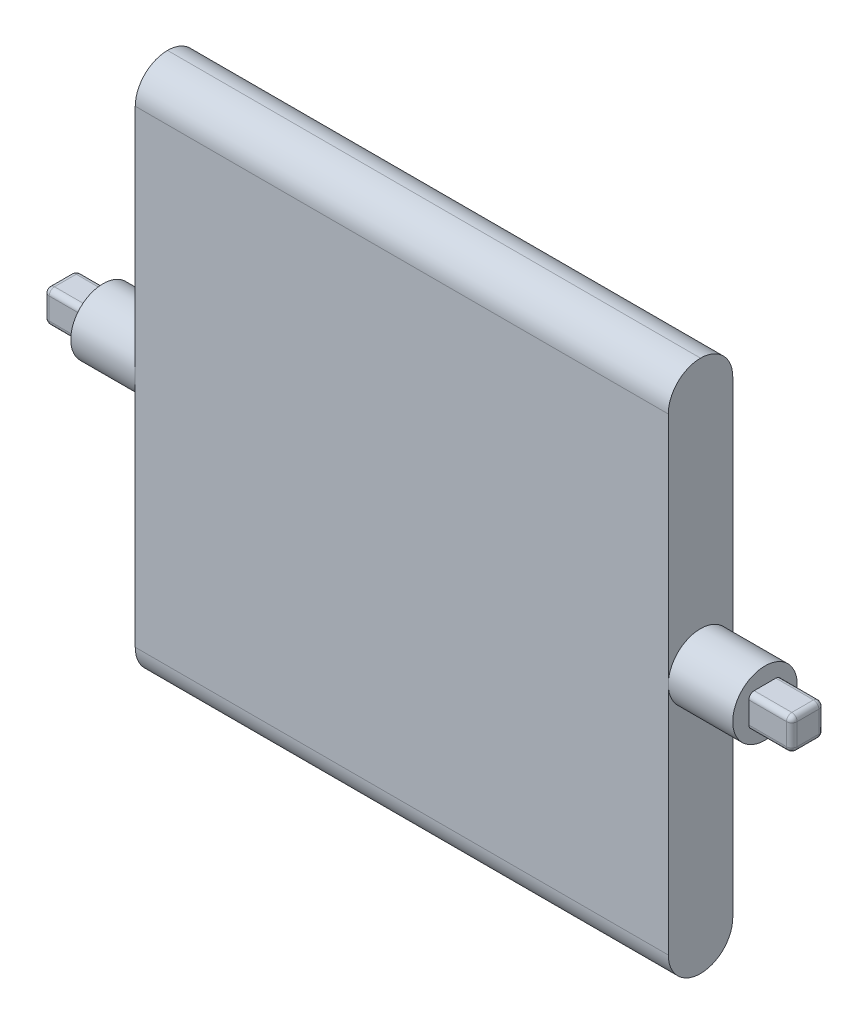
from build123d import *

# Parameters (mm, degrees)
SKETCH1_W           = 78.74
SKETCH1_H           = 78.74
BOSS_EXTRUDE1_DEPTH = 4.7625
SKETCH2_R           = 4.7625
BOSS_EXTRUDE2_DEPTH = 9.525
SKETCH3_W           = 4.7752
SKETCH3_H           = 4.7752
BOSS_EXTRUDE3_DEPTH = 6.35
FILLET2_R           = 4.7625
FILLET3_R           = 0.7874
FILLET4_R           = 0.7874
FILLET5_R           = 0.7874


# Some blends are built 0.0001 mm under size
with BuildPart() as part:
    # Sketch1 → Boss-Extrude1 (new, symmetric)
    with BuildSketch(Plane.XY):
        Rectangle(SKETCH1_W, SKETCH1_H)
    extrude(amount=BOSS_EXTRUDE1_DEPTH, both=True)

    # Sketch2 → Boss-Extrude2 (add)
    with BuildSketch(Plane(origin=(39.37, 0, 0), x_dir=(0, 0, -1), z_dir=(1, 0, 0))):
        Circle(SKETCH2_R)
    boss_extrude2 = extrude(amount=BOSS_EXTRUDE2_DEPTH)

    # Sketch3 → Boss-Extrude3 (add)
    with BuildSketch(Plane(origin=(48.895, 0, 0), x_dir=(0, 0, -1), z_dir=(1, 0, 0))):
        Rectangle(SKETCH3_W, SKETCH3_H)
    boss_extrude3 = extrude(amount=BOSS_EXTRUDE3_DEPTH)

    # Mirror1: Boss-Extrude2, Boss-Extrude3 across plane
    add(boss_extrude2.mirror(Plane(origin=(0, 0, 0), x_dir=(0, 0, 1), z_dir=(1, 0, 0))))
    add(boss_extrude3.mirror(Plane(origin=(0, 0, 0), x_dir=(0, 0, 1), z_dir=(1, 0, 0))))

    # Fillet2
    fillet2_edges = [part.edges().sort_by_distance(p)[0] for p in [
        (0, -39.37, -4.7625),
        (0, -39.37, 4.7625),
        (0, 39.37, -4.7625),
        (0, 39.37, 4.7625),
    ]]
    fillet(fillet2_edges, radius=FILLET2_R - 0.0001)  # a hair under: the kernel refuses the full size

    # Fillet3
    fillet3_edges = [part.edges().sort_by_distance(p)[0] for p in [
        (-55.245, 0, -2.3876),
        (-55.245, -2.3876, 0),
        (-55.245, 0, 2.3876),
        (-55.245, 2.3876, 0),
    ]]
    fillet(fillet3_edges, radius=FILLET3_R)

    # Fillet4
    fillet4_edges = [part.edges().sort_by_distance(p)[0] for p in [
        (55.245, 0, -2.3876),
        (55.245, 2.3876, 0),
        (55.245, 0, 2.3876),
        (55.245, -2.3876, 0),
    ]]
    fillet(fillet4_edges, radius=FILLET4_R)

    # Fillet5
    # the kernel refuses this fillet: 0.7874 mm, written as the material it takes off along each edge
    with BuildSketch(Plane(origin=(54.4576, -1.6002, -1.6002), x_dir=(0, 0, -1), z_dir=(0, -1, 0))) as fillet5_piece_1_section:
        Polygon((0, 0), (FILLET5_R, 0), (FILLET5_R, FILLET5_R), (0, FILLET5_R), align=None)
    fillet5_piece_1 = extrude(amount=FILLET5_R, mode=Mode.PRIVATE)
    fillet5_piece_1 = fillet5_piece_1 - Plane(origin=(54.4576, -1.6002, -1.6002), x_dir=(-0.7071067811865475, 0, 0.7071067811865475), z_dir=(0, -1, 0)) * Sphere(FILLET5_R, mode=Mode.PRIVATE)
    add(fillet5_piece_1, mode=Mode.SUBTRACT)
    with BuildSketch(Plane(origin=(54.4576, -1.6002, 1.6002), x_dir=(0, 0, 1), z_dir=(0, -1, 0))) as fillet5_piece_2_section:
        Polygon((0, 0), (FILLET5_R, 0), (FILLET5_R, -FILLET5_R), (0, -FILLET5_R), align=None)
    fillet5_piece_2 = extrude(amount=FILLET5_R, mode=Mode.PRIVATE)
    fillet5_piece_2 = fillet5_piece_2 - Plane(origin=(54.4576, -1.6002, 1.6002), x_dir=(-0.7071067811865475, 0, -0.7071067811865475), z_dir=(0, -1, 0)) * Sphere(FILLET5_R, mode=Mode.PRIVATE)
    add(fillet5_piece_2, mode=Mode.SUBTRACT)
    with BuildSketch(Plane(origin=(54.4576, 1.6002, -1.6002), x_dir=(0, 1, 0), z_dir=(0, 0, -1))) as fillet5_piece_3_section:
        Polygon((0, 0), (FILLET5_R, 0), (FILLET5_R, FILLET5_R), (0, FILLET5_R), align=None)
    fillet5_piece_3 = extrude(amount=FILLET5_R, mode=Mode.PRIVATE)
    fillet5_piece_3 = fillet5_piece_3 - Plane(origin=(54.4576, 1.6002, -1.6002), x_dir=(-0.7071067811865475, -0.7071067811865475, 0), z_dir=(0, 0, -1)) * Sphere(FILLET5_R, mode=Mode.PRIVATE)
    add(fillet5_piece_3, mode=Mode.SUBTRACT)
    with BuildSketch(Plane(origin=(54.4576, 1.6002, 1.6002), x_dir=(0, 1, 0), z_dir=(0, 0, 1))) as fillet5_piece_4_section:
        Polygon((0, 0), (FILLET5_R, 0), (FILLET5_R, -FILLET5_R), (0, -FILLET5_R), align=None)
    fillet5_piece_4 = extrude(amount=FILLET5_R, mode=Mode.PRIVATE)
    fillet5_piece_4 = fillet5_piece_4 - Plane(origin=(54.4576, 1.6002, 1.6002), x_dir=(-0.7071067811865475, -0.7071067811865475, 0), z_dir=(0, 0, 1)) * Sphere(FILLET5_R, mode=Mode.PRIVATE)
    add(fillet5_piece_4, mode=Mode.SUBTRACT)
    with BuildSketch(Plane(origin=(-54.4576, 1.6002, 1.6002), x_dir=(0, 0, 1), z_dir=(0, 1, 0))) as fillet5_piece_5_section:
        Polygon((0, 0), (FILLET5_R, 0), (FILLET5_R, -FILLET5_R), (0, -FILLET5_R), align=None)
    fillet5_piece_5 = extrude(amount=FILLET5_R, mode=Mode.PRIVATE)
    fillet5_piece_5 = fillet5_piece_5 - Plane(origin=(-54.4576, 1.6002, 1.6002), x_dir=(0.7071067811865475, 0, -0.7071067811865475), z_dir=(0, 1, 0)) * Sphere(FILLET5_R, mode=Mode.PRIVATE)
    add(fillet5_piece_5, mode=Mode.SUBTRACT)
    with BuildSketch(Plane(origin=(-54.4576, 1.6002, -1.6002), x_dir=(0, 1, 0), z_dir=(0, 0, -1))) as fillet5_piece_6_section:
        Polygon((0, 0), (FILLET5_R, 0), (FILLET5_R, -FILLET5_R), (0, -FILLET5_R), align=None)
    fillet5_piece_6 = extrude(amount=FILLET5_R, mode=Mode.PRIVATE)
    fillet5_piece_6 = fillet5_piece_6 - Plane(origin=(-54.4576, 1.6002, -1.6002), x_dir=(0.7071067811865475, -0.7071067811865475, 0), z_dir=(0, 0, -1)) * Sphere(FILLET5_R, mode=Mode.PRIVATE)
    add(fillet5_piece_6, mode=Mode.SUBTRACT)
    with BuildSketch(Plane(origin=(-54.4576, -1.6002, 1.6002), x_dir=(0, 0, 1), z_dir=(0, -1, 0))) as fillet5_piece_7_section:
        Polygon((0, 0), (FILLET5_R, 0), (FILLET5_R, FILLET5_R), (0, FILLET5_R), align=None)
    fillet5_piece_7 = extrude(amount=FILLET5_R, mode=Mode.PRIVATE)
    fillet5_piece_7 = fillet5_piece_7 - Plane(origin=(-54.4576, -1.6002, 1.6002), x_dir=(0.7071067811865475, 0, -0.7071067811865475), z_dir=(0, -1, 0)) * Sphere(FILLET5_R, mode=Mode.PRIVATE)
    add(fillet5_piece_7, mode=Mode.SUBTRACT)
    with BuildSketch(Plane(origin=(-54.4576, -1.6002, -1.6002), x_dir=(0, 0, -1), z_dir=(0, -1, 0))) as fillet5_piece_8_section:
        Polygon((0, 0), (FILLET5_R, 0), (FILLET5_R, -FILLET5_R), (0, -FILLET5_R), align=None)
    fillet5_piece_8 = extrude(amount=FILLET5_R, mode=Mode.PRIVATE)
    fillet5_piece_8 = fillet5_piece_8 - Plane(origin=(-54.4576, -1.6002, -1.6002), x_dir=(0.7071067811865475, 0, 0.7071067811865475), z_dir=(0, -1, 0)) * Sphere(FILLET5_R, mode=Mode.PRIVATE)
    add(fillet5_piece_8, mode=Mode.SUBTRACT)
    with BuildSketch(Plane(origin=(48.895, -2.3876, -2.3876), x_dir=(0, 0, 1), z_dir=(1, 0, 0)), Plane(origin=(-48.895, -2.3876, 2.3876), x_dir=(0, 0, -1), z_dir=(-1, 0, 0)), Plane(origin=(48.895, 2.3876, -2.3876), x_dir=(0, -1, 0), z_dir=(1, 0, 0))) as fillet5_piece_9:
        with BuildLine():
            CenterArc((FILLET5_R, -FILLET5_R), FILLET5_R, 90, 90)
            Line((0, -FILLET5_R), (0, 0))
            Line((0, 0), (FILLET5_R, 0))
        make_face()
    extrude(amount=5.5626, mode=Mode.SUBTRACT)
    with BuildSketch(Plane(origin=(-48.895, -2.3876, -2.3876), x_dir=(0, 0, 1), z_dir=(-1, 0, 0)), Plane(origin=(-48.895, 2.3876, -2.3876), x_dir=(0, -1, 0), z_dir=(-1, 0, 0)), Plane(origin=(-48.895, 2.3876, 2.3876), x_dir=(0, 0, -1), z_dir=(-1, 0, 0)), Plane(origin=(48.895, 2.3876, 2.3876), x_dir=(0, -1, 0), z_dir=(1, 0, 0)), Plane(origin=(48.895, -2.3876, 2.3876), x_dir=(0, 0, -1), z_dir=(1, 0, 0))) as fillet5_piece_10:
        with BuildLine():
            CenterArc((FILLET5_R, FILLET5_R), FILLET5_R, 180, 90)
            Line((0, FILLET5_R), (0, 0))
            Line((0, 0), (FILLET5_R, 0))
        make_face()
    extrude(amount=5.5626, mode=Mode.SUBTRACT)


solid = part.part
